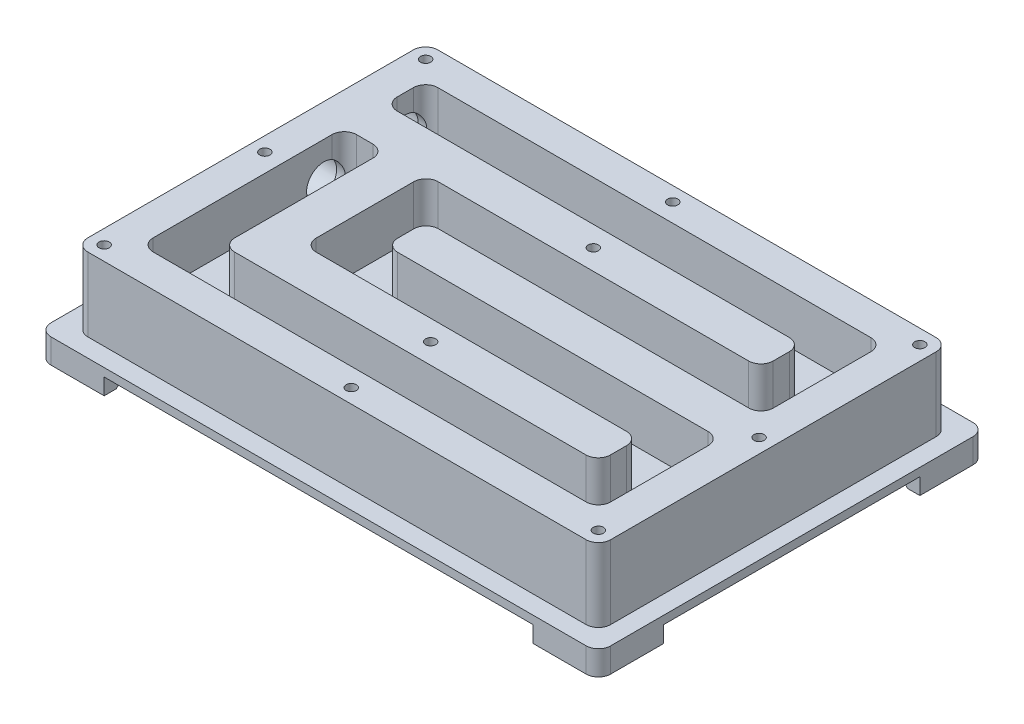
from build123d import *

# Parameters (mm, degrees)
SKETCH1_W                         = 128
SKETCH1_H                         = 85.7
BOSS_EXTRUDE1_DEPTH               = 18
CUT_EXTRUDE1_DEPTH                = 12
M3X0_5_TAPPED_HOLE1_D             = 2.5
M3X0_5_TAPPED_HOLE1_DEPTH         = 10
M3X0_5_TAPPED_HOLE1_TIP           = 0.751075774
SKETCH10_W                        = 137
SKETCH10_H                        = 94.7
BOSS_EXTRUDE2_DEPTH               = 6
CUT_EXTRUDE2_DEPTH                = 4
SKETCH12_W                        = 4.5
SKETCH12_H                        = 62.7
SKETCH12_W_2                      = 105
SKETCH12_H_2                      = 4.475
CUT_EXTRUDE3_DEPTH                = 4
CHAMFER1_SIZE                     = 1.5
FILLET1_R                         = 3
F_1_8_NPT_TAPPED_HOLE1_AT_2_COUNT = 2
F_1_8_NPT_TAPPED_HOLE1_AT_2_PITCH = 19.935714286


with BuildPart() as part:
    # Sketch1 → Boss-Extrude1 (new body)
    with BuildSketch(Plane(origin=(0, 0, 0), x_dir=(1, 0, 0), z_dir=(0, 1, 0))):
        Rectangle(SKETCH1_W, SKETCH1_H)
    extrude(amount=BOSS_EXTRUDE1_DEPTH)

    # Sketch2 → Cut-Extrude1 (cut)
    with BuildSketch(Plane(origin=(0, 18, 0), x_dir=(1, 0, 0), z_dir=(0, 1, 0))):
        with BuildLine():
            Line((-46, 11.935714286), (-46, -21.892857143))
            ThreePointArc((-46, -21.892857143), (-45.121320344, -24.014177486), (-43, -24.892857143))
            Line((-43, -24.892857143), (43, -24.892857143))
            ThreePointArc((43, -24.892857143), (45.121320344, -24.014177486), (46, -21.892857143))
            Line((46, -21.892857143), (46, -17.935714286))
            ThreePointArc((46, -17.935714286), (45.121320344, -15.814393942), (43, -14.935714286))
            Line((43, -14.935714286), (-33, -14.935714286))
            ThreePointArc((-33, -14.935714286), (-35.121320344, -14.057034629), (-36, -11.935714286))
            Line((-36, -11.935714286), (-36, 11.935714286))
            ThreePointArc((-36, 11.935714286), (-35.121320344, 14.057034629), (-33, 14.935714286))
            Line((-33, 14.935714286), (43, 14.935714286))
            ThreePointArc((43, 14.935714286), (45.121320344, 15.814393942), (46, 17.935714286))
            Line((46, 17.935714286), (46, 21.892857143))
            ThreePointArc((46, 21.892857143), (45.121320344, 24.014177486), (43, 24.892857143))
            Line((43, 24.892857143), (-53, 24.892857143))
            ThreePointArc((-53, 24.892857143), (-55.121320344, 25.771536799), (-56, 27.892857143))
            Line((-56, 27.892857143), (-56, 31.85))
            ThreePointArc((-56, 31.85), (-55.121320344, 33.971320344), (-53, 34.85))
            Line((-53, 34.85), (53, 34.85))
            ThreePointArc((53, 34.85), (55.121320344, 33.971320344), (56, 31.85))
            Line((56, 31.85), (56, 7.978571429))
            ThreePointArc((56, 7.978571429), (55.121320344, 5.857251085), (53, 4.978571429))
            Line((53, 4.978571429), (-23, 4.978571429))
            ThreePointArc((-23, 4.978571429), (-25.121320344, 4.099891772), (-26, 1.978571429))
            Line((-26, 1.978571429), (-26, -1.978571429))
            ThreePointArc((-26, -1.978571429), (-25.121320344, -4.099891772), (-23, -4.978571429))
            Line((-23, -4.978571429), (53, -4.978571429))
            ThreePointArc((53, -4.978571429), (55.121320344, -5.857251085), (56, -7.978571429))
            Line((56, -7.978571429), (56, -31.85))
            ThreePointArc((56, -31.85), (55.121320344, -33.971320344), (53, -34.85))
            Line((53, -34.85), (-53, -34.85))
            ThreePointArc((-53, -34.85), (-55.121320344, -33.971320344), (-56, -31.85))
            Line((-56, -31.85), (-56, 11.935714286))
            ThreePointArc((-56, 11.935714286), (-55.121320344, 14.057034629), (-53, 14.935714286))
            Line((-53, 14.935714286), (-49, 14.935714286))
            ThreePointArc((-49, 14.935714286), (-46.878679656, 14.057034629), (-46, 11.935714286))
        make_face()
    extrude(amount=-CUT_EXTRUDE1_DEPTH, mode=Mode.SUBTRACT)

    # M3x0.5 Tapped Hole1
    with Locations(Plane(origin=(0, 18, 0), x_dir=(1, 0, 0), z_dir=(0, 1, 0))):
        with Locations((-60.5, 39.35), (0, 39.35), (60.5, 39.35), (60.5, 0), (60.5, -39.35), (0, -39.35), (-60.5, -39.35), (-60.5, 0), (0, 19.914285714), (0, -19.914285714)):
            Hole(M3X0_5_TAPPED_HOLE1_D / 2, depth=M3X0_5_TAPPED_HOLE1_DEPTH)
            with Locations((0, 0, -(M3X0_5_TAPPED_HOLE1_DEPTH + M3X0_5_TAPPED_HOLE1_TIP / 2))):  # 118° drill point
                Cone(0, M3X0_5_TAPPED_HOLE1_D / 2, M3X0_5_TAPPED_HOLE1_TIP, mode=Mode.SUBTRACT)

    # Sketch10 → Boss-Extrude2 (add)
    with BuildSketch(Plane.XZ):
        Rectangle(SKETCH10_W, SKETCH10_H)
    extrude(amount=BOSS_EXTRUDE2_DEPTH)

    # Sketch11 → Cut-Extrude2 (cut)
    with BuildSketch(Plane.XZ.offset(6)):
        with BuildLine():
            Line((-62.5, -42.875), (62.5, -42.875))
            ThreePointArc((62.5, -42.875), (65.060660172, -43.935660172), (64, -41.375))
            Line((64, -41.375), (64, 41.375))
            ThreePointArc((64, 41.375), (65.060660172, 43.935660172), (62.5, 42.875))
            Line((62.5, 42.875), (-62.5, 42.875))
            ThreePointArc((-62.5, 42.875), (-65.060660172, 43.935660172), (-64, 41.375))
            Line((-64, 41.375), (-64, -41.375))
            ThreePointArc((-64, -41.375), (-65.060660172, -43.935660172), (-62.5, -42.875))
        make_face()
    extrude(amount=-CUT_EXTRUDE2_DEPTH, mode=Mode.SUBTRACT)

    # Sketch12 → Cut-Extrude3 (cut)
    with BuildSketch(Plane.XZ.offset(6)):
        with Locations((-66.25, 0)):
            Rectangle(SKETCH12_W, SKETCH12_H)
        with Locations((66.25, 0)):
            Rectangle(SKETCH12_W, SKETCH12_H)
        with Locations((0, 45.1125)):
            Rectangle(SKETCH12_W_2, SKETCH12_H_2)
        with Locations((0, -45.1125)):
            Rectangle(SKETCH12_W_2, SKETCH12_H_2)
    extrude(amount=-CUT_EXTRUDE3_DEPTH, mode=Mode.SUBTRACT)

    # Chamfer1
    chamfer1_edges = [part.edges().sort_by_distance(p)[0] for p in [
        (-64, -6, 36.3625),
        (-57.5, -6, -42.875),
        (64, -6, -36.3625),
        (57.5, -6, 42.875),
        (-64, -6, -36.3625),
        (57.5, -6, -42.875),
        (64, -6, 36.3625),
        (-57.5, -6, 42.875),
    ]]
    chamfer(chamfer1_edges, length=CHAMFER1_SIZE - 0.0001)  # a hair under: the kernel refuses the full size

    # Fillet1
    fillet1_edges = [part.edges().sort_by_distance(p)[0] for p in [
        (-68.5, -3, -47.35),
        (68.5, -3, -47.35),
        (68.5, -3, 47.35),
        (-68.5, -3, 47.35),
        (64, 9, 42.85),
        (-64, 9, 42.85),
        (-64, 9, -42.85),
        (64, 9, -42.85),
    ]]
    fillet(fillet1_edges, radius=FILLET1_R)

    # Sketch14 → 1/8 NPT Tapped Hole1 (revolve, cut)
    with BuildSketch(Plane(origin=(-64, 9, -29.871428571), x_dir=(0, 0, 1), z_dir=(0, 1, 0))):
        Polygon((0, 0), (0, 14.153468714), (4.2164, 11.62), (4.2164, 6.92), (4.936178933, 6.92), (5.143373, 0), align=None)
    f_1_8_npt_tapped_hole1 = revolve(axis=Axis((-70.35, 9, -29.871428571), (1, 0, 0)), mode=Mode.SUBTRACT)

    # 1/8 NPT Tapped Hole1 at 2: 1/8 NPT Tapped Hole1 ×2
    with Locations(*[(0, 0, i * F_1_8_NPT_TAPPED_HOLE1_AT_2_PITCH) for i in range(1, F_1_8_NPT_TAPPED_HOLE1_AT_2_COUNT)]):
        add(f_1_8_npt_tapped_hole1, mode=Mode.SUBTRACT)


solid = part.part
